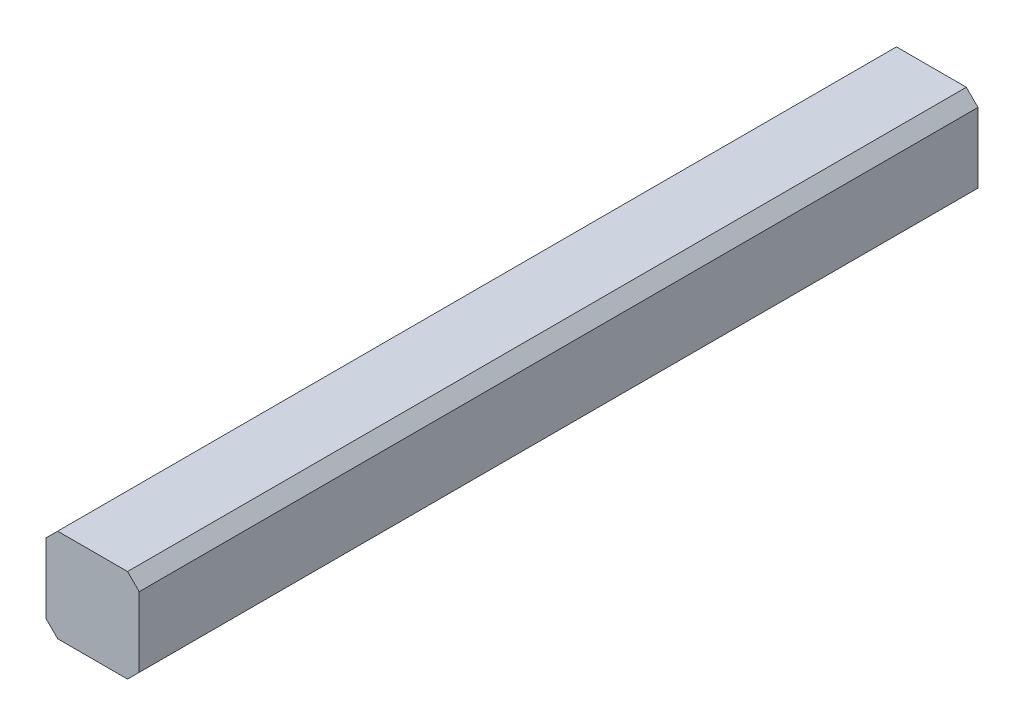
from build123d import *

# Parameters (mm, degrees)
BODY_W         = 2
BODY_H         = 2
EXTRUDE1_DEPTH = 18
CHAMFER1_SIZE  = 0.25


with BuildPart() as part:
    # body → Extrude1 (new body)
    with BuildSketch(Plane.XY):
        with Locations((1, 1)):
            Rectangle(BODY_W, BODY_H)
    extrude(amount=EXTRUDE1_DEPTH)

    # Chamfer1
    chamfer1_edges = [part.edges().sort_by_distance(p)[0] for p in [
        (0, 0, 9),
        (2, 0, 9),
        (2, 2, 9),
        (0, 2, 9),
    ]]
    chamfer(chamfer1_edges, length=CHAMFER1_SIZE)


solid = part.part
